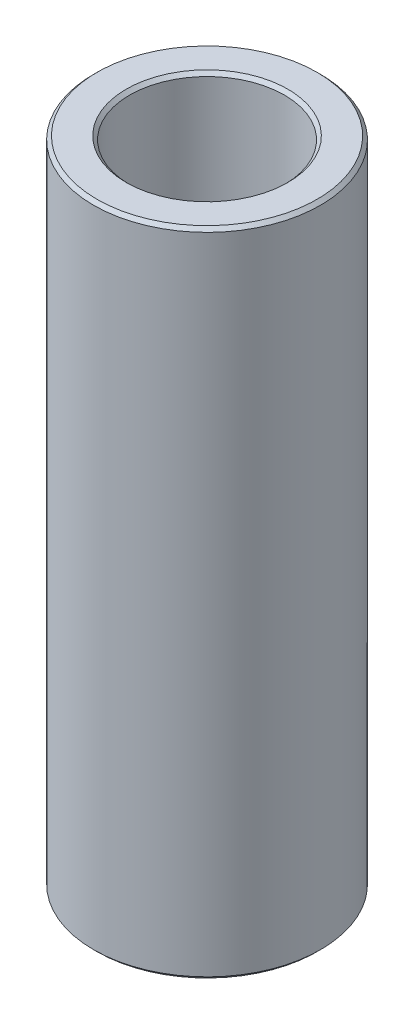
from build123d import *

# Parameters (mm, degrees)
SKETCH1_R           = 50
BOSS_EXTRUDE1_DEPTH = 287.154505729
SKETCH2_R           = 34.129316189
CUT_EXTRUDE1_DEPTH  = 296.73249764
CHAMFER1_SIZE       = 1.505028649


with BuildPart() as part:
    # Sketch1 → Boss-Extrude1 (new body)
    with BuildSketch(Plane(origin=(0, 0, 0), x_dir=(1, 0, 0), z_dir=(0, 1, 0))):
        Circle(SKETCH1_R)
    extrude(amount=BOSS_EXTRUDE1_DEPTH)

    # Sketch2 → Cut-Extrude1 (cut, through all)
    with BuildSketch(Plane(origin=(0, 0, 0), x_dir=(1, 0, 0), z_dir=(0, 1, 0))):
        Circle(SKETCH2_R)
    extrude(amount=CUT_EXTRUDE1_DEPTH, mode=Mode.SUBTRACT)

    # Chamfer1
    chamfer1_edges = [part.edges().sort_by_distance(p)[0] for p in [
        (-34.129316189, 287.154505729, 0),
        (-34.129316189, 0, 0),
        (-50, 0, 0),
        (-50, 287.154505729, 0),
    ]]
    chamfer(chamfer1_edges, length=CHAMFER1_SIZE)


solid = part.part
